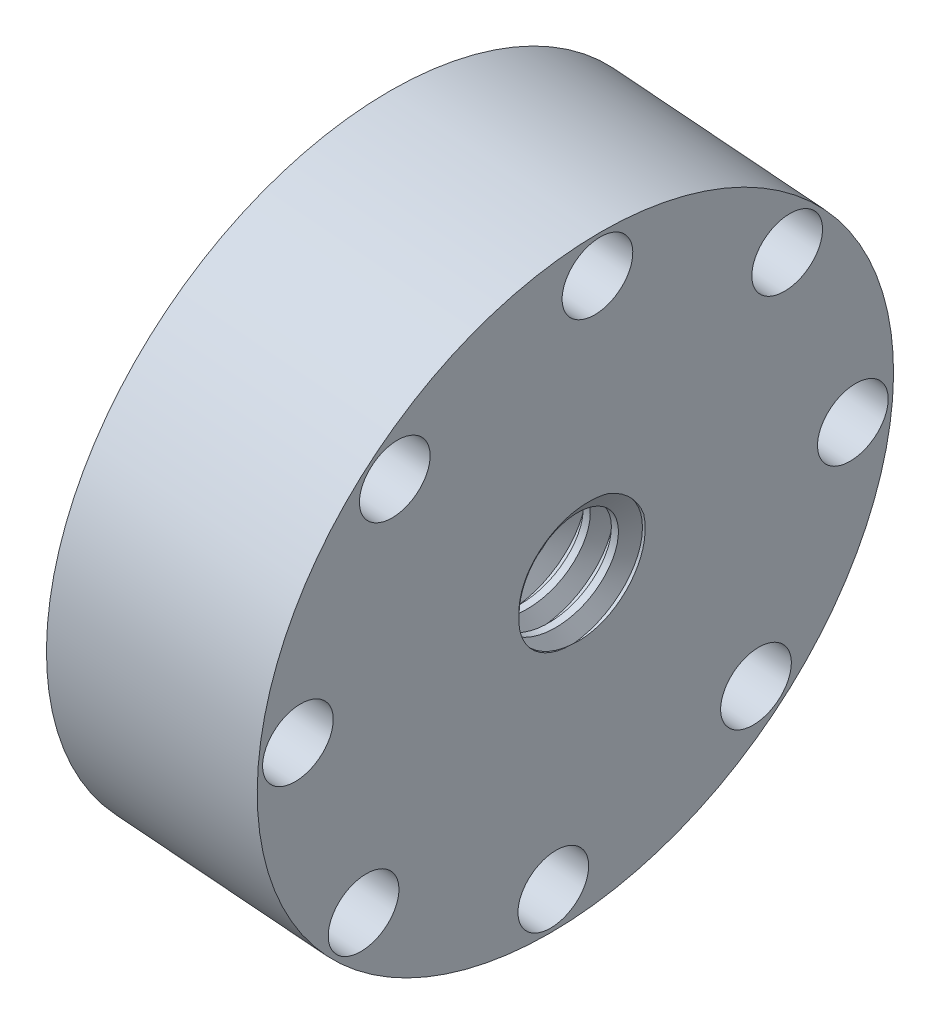
from build123d import *

# Parameters (mm, degrees)
SKETCH1_R           = 14.2875
BOSS_EXTRUDE1_DEPTH = 9.525
SKETCH2_R           = 2.54
CUT_EXTRUDE1_DEPTH  = 6.35
SKETCH3_R           = 1.5875
CUT_EXTRUDE2_DEPTH  = 10
THREAD1_PITCH       = 1.27


with BuildPart() as part:
    # Sketch1 → Boss-Extrude1 (new body)
    with BuildSketch(Plane(origin=(234.278878836, -18.689027227, 0), x_dir=(0, 0, -1), z_dir=(0.9968332748770866, -0.0795199477981641, 0))):
        with Locations(Location((-43.174261814, 8.550344032, 0), (0, 0, 90))):
            Circle(SKETCH1_R)
    extrude(amount=-BOSS_EXTRUDE1_DEPTH)

    # Sketch2 → Cut-Extrude1 (cut)
    with BuildSketch(Plane(origin=(234.278878836, -18.689027227, 0), x_dir=(0, 0, -1), z_dir=(0.9968332748770866, -0.07951994779816411, 0))):
        with Locations(Location((-43.174261814, 8.550344032, 0), (0, 0, 90))):
            Circle(SKETCH2_R)
    extrude(amount=-CUT_EXTRUDE1_DEPTH, mode=Mode.SUBTRACT)

    # Sketch3 → Cut-Extrude2 (cut)
    with BuildSketch(Plane(origin=(224.784041893, -17.931599724, 0), x_dir=(0, 0, 1), z_dir=(-0.9968332748770866, 0.07951994779816411, 0))):
        with Locations(Location((30.674261814, 8.550344032, 0), (0, 0, 270))):
            Circle(SKETCH3_R)
        with Locations(Location((43.174261814, 21.050344032, 0), (0, 0, 270))):
            Circle(SKETCH3_R)
        with Locations(Location((52.013096579, 17.389178797, 0), (0, 0, 270))):
            Circle(SKETCH3_R)
        with Locations(Location((55.674261814, 8.550344032, 0), (0, 0, 270))):
            Circle(SKETCH3_R)
        with Locations(Location((52.013096579, -0.288490733, 0), (0, 0, 270))):
            Circle(SKETCH3_R)
        with Locations(Location((43.174261814, -3.949655968, 0), (0, 0, 270))):
            Circle(SKETCH3_R)
        with Locations(Location((34.33542705, -0.288490733, 0), (0, 0, 270))):
            Circle(SKETCH3_R)
        with Locations(Location((34.33542705, 17.389178797, 0), (0, 0, 270))):
            Circle(SKETCH3_R)
    extrude(amount=-CUT_EXTRUDE2_DEPTH, mode=Mode.SUBTRACT)

    # Thread1: the profile of Thread Profile1 profile screwed along a right-hand helix of 5 turns, 8 arcs to a turn; built about Z, then put on its axis
    thread1_z = Axis((0, 0, 0), (0, 0, 1))
    thread1_corners = [(2.5397, 0, -0.000173205), (3.227407662, 0, 0.396874998), (3.227407662, 0, 0.555624998), (2.5397, 0, 0.952673201)]
    with BuildLine(mode=Mode.PRIVATE) as thread1_profile:
        Line(thread1_corners[0], thread1_corners[1])
        Line(thread1_corners[1], thread1_corners[2])
        Line(thread1_corners[2], thread1_corners[3])
        Line(thread1_corners[3], thread1_corners[0])
    thread1_cap = Face(thread1_profile.wire())
    thread1_turn_angles = [0, 22.5, 45, 67.5, 90, 112.5, 135, 157.5, 180, 202.5, 225, 247.5, 270, 292.5, 315, 337.5, 360]
    thread1_turn_weights = [1, 0.9238795325112867, 1, 0.9238795325112867, 1, 0.9238795325112867, 1, 0.9238795325112867, 1, 0.9238795325112867, 1, 0.9238795325112867, 1, 0.9238795325112867, 1, 0.9238795325112867, 1]
    thread1_turn_rails = [Edge.make_bspline([Vector(p[0], p[1], 0).rotate(thread1_z, thread1_turn_angles[k]) / thread1_turn_weights[k] + Vector(0, 0, p[2] + THREAD1_PITCH * thread1_turn_angles[k] / 360) for k in range(17)], [0, 0, 0, 1, 1, 2, 2, 3, 3, 4, 4, 5, 5, 6, 6, 7, 7, 8, 8, 8], 2, thread1_turn_weights) for p in thread1_corners]
    thread1_turn_sides = [Face.make_surface_from_curves(thread1_turn_rails[p[0]], thread1_turn_rails[p[1]]) for p in [(0, 1), (1, 2), (2, 3), (3, 0)]]
    thread1 = Plane(origin=(235.908285441, -10.241502535, 43.174261814), x_dir=(0, 0, 1), z_dir=(-0.996833275, 0.079519948, 0)) * Solid(Shell([*[p.moved(Location((0, 0, THREAD1_PITCH * i))) for i in range(5) for p in thread1_turn_sides], thread1_cap, thread1_cap.rotate(thread1_z, 1800).moved(Location((0, 0, THREAD1_PITCH * 1800 / 360)))]))
    add(thread1, mode=Mode.SUBTRACT)


solid = part.part
